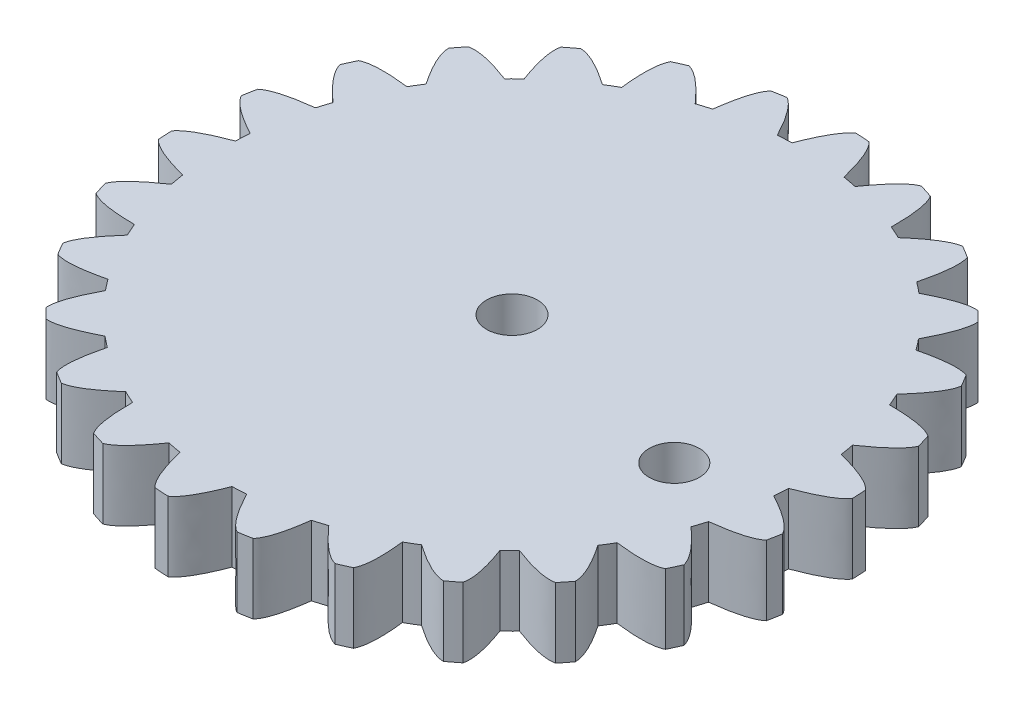
from build123d import *

# Parameters (mm, degrees)
BOSS_EXTRUDE4_DEPTH = 5
CIRPATTERN6_COUNT   = 26
SKETCH2_R           = 1.825
CUT_EXTRUDE2_DEPTH  = 10
SKETCH4_R           = 1.8
CUT_EXTRUDE3_DEPTH  = 10


with BuildPart() as part:
    # Sketch1 → Boss-Extrude4 (new body)
    with BuildSketch(Plane(origin=(0, 0, 0), x_dir=(1, 0, 0), z_dir=(0, 1, 0))):
        with BuildLine():
            ThreePointArc((17.12650265, 16.227713079), (16.778754951, 16.587017426), (16.42347089, 16.938871531))
            add(Edge.make_bspline(
                [(16.42347089, 16.938871531), (15.470818898, 17.049534333), (13.241404762, 15.89802506)],
                knots=[0.625194879, 0.625194879, 0.625194879, 1, 1, 1], degree=2))
            ThreePointArc((13.241404762, 15.89802506), (-14.713969781, -14.54582738), (16.049154429, 13.057819228))
            add(Edge.make_bspline(
                [(16.049154429, 13.057819228), (17.226209612, 15.273852191), (17.12650265, 16.227713079)],
                knots=[0, 0, 0, 0.374805121, 0.374805121, 0.374805121], degree=2))
        make_face()
    boss_extrude4 = extrude(amount=BOSS_EXTRUDE4_DEPTH)

    # CirPattern6: Boss-Extrude4 ×26 about axis
    cirpattern6_axis = Axis((0, 5, 0), (0, 1, 0))
    for i in range(1, CIRPATTERN6_COUNT):
        add(boss_extrude4.rotate(cirpattern6_axis, i * 360 / CIRPATTERN6_COUNT))

    # Sketch2 → Cut-Extrude2 (cut)
    with BuildSketch(Plane(origin=(0, 5, 0), x_dir=(1, 0, 0), z_dir=(0, 1, 0))):
        Circle(SKETCH2_R)
    extrude(amount=-CUT_EXTRUDE2_DEPTH, mode=Mode.SUBTRACT)

    # Sketch4 → Cut-Extrude3 (cut)
    with BuildSketch(Plane.XZ):
        with Locations((15, 3.380352036)):
            Circle(SKETCH4_R)
    extrude(amount=-CUT_EXTRUDE3_DEPTH, mode=Mode.SUBTRACT)


solid = part.part
